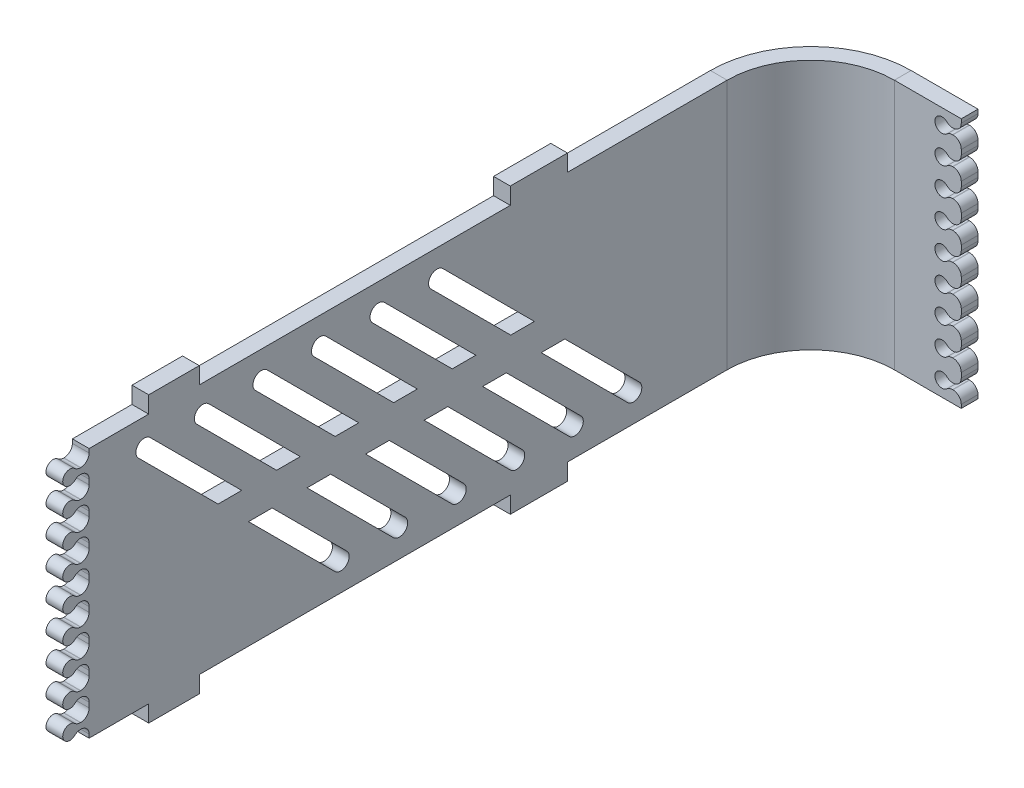
from build123d import *

# Parameters (mm, degrees)
BOSS_EXTRUDE1_DEPTH          = 5.08
EDGE_FLANGE1_STRIP_W         = 76.2
EDGE_FLANGE1_STRIP_H         = 5.08
EDGE_FLANGE1_STRIP_CUT_DEPTH = 76.2
EDGE_FLANGE1_DEPTH           = 76.2
EDGE_FLANGE1_START           = 5.08
EDGE_FLANGE1_FLAT_DEPTH      = 5.08
CUT_EXTRUDE2_DEPTH           = 242.670544012


# Sheet-metal steps are written as plain solids
with BuildPart() as part:
    # Sketch1 → Boss-Extrude1 (new body)
    with BuildSketch(Plane.XY):
        with BuildLine():
            Line((12.7, -38.1), (12.7, -37.011825379))
            ThreePointArc((12.7, -37.011825379), (11.956051224, -35.215774155), (10.16, -34.471825379))
            Line((10.16, -34.471825379), (10.028134089, -34.471825379))
            ThreePointArc((10.028134089, -34.471825379), (9.111928379, -34.642824093), (8.319084872, -35.132796169))
            ThreePointArc((8.319084872, -35.132796169), (4.69036112, -33.498380336), (8.362360336, -31.963657905))
            ThreePointArc((8.362360336, -31.963657905), (9.173613419, -32.48826627), (10.122080076, -32.6719957))
            Line((10.122080076, -32.6719957), (10.16, -32.6719957))
            ThreePointArc((10.16, -32.6719957), (11.956051224, -31.928046924), (12.7, -30.1319957))
            Line((12.7, -30.1319957), (12.7, -28.629825379))
            ThreePointArc((12.7, -28.629825379), (11.956051224, -26.833774155), (10.16, -26.089825379))
            Line((10.16, -26.089825379), (10.028134089, -26.089825379))
            ThreePointArc((10.028134089, -26.089825379), (9.111928379, -26.260824093), (8.319084872, -26.750796169))
            ThreePointArc((8.319084872, -26.750796169), (4.69036112, -25.116380336), (8.362360336, -23.581657905))
            ThreePointArc((8.362360336, -23.581657905), (9.173613419, -24.10626627), (10.122080076, -24.2899957))
            Line((10.122080076, -24.2899957), (10.16, -24.2899957))
            ThreePointArc((10.16, -24.2899957), (11.956051224, -23.546046924), (12.7, -21.7499957))
            Line((12.7, -21.7499957), (12.7, -20.247825379))
            ThreePointArc((12.7, -20.247825379), (11.956051224, -18.451774155), (10.16, -17.707825379))
            Line((10.16, -17.707825379), (10.028134089, -17.707825379))
            ThreePointArc((10.028134089, -17.707825379), (9.111928379, -17.878824093), (8.319084872, -18.368796169))
            ThreePointArc((8.319084872, -18.368796169), (4.69036112, -16.734380336), (8.362360336, -15.199657905))
            ThreePointArc((8.362360336, -15.199657905), (9.173613419, -15.72426627), (10.122080076, -15.9079957))
            Line((10.122080076, -15.9079957), (10.16, -15.9079957))
            ThreePointArc((10.16, -15.9079957), (11.956051224, -15.164046924), (12.7, -13.3679957))
            Line((12.7, -13.3679957), (12.7, -11.865825379))
            ThreePointArc((12.7, -11.865825379), (11.956051224, -10.069774155), (10.16, -9.325825379))
            Line((10.16, -9.325825379), (10.028134089, -9.325825379))
            ThreePointArc((10.028134089, -9.325825379), (9.111928379, -9.496824093), (8.319084872, -9.986796169))
            ThreePointArc((8.319084872, -9.986796169), (4.69036112, -8.352380336), (8.362360336, -6.817657905))
            ThreePointArc((8.362360336, -6.817657905), (9.173613419, -7.34226627), (10.122080076, -7.5259957))
            Line((10.122080076, -7.5259957), (10.16, -7.5259957))
            ThreePointArc((10.16, -7.5259957), (11.956051224, -6.782046924), (12.7, -4.9859957))
            Line((12.7, -4.9859957), (12.7, -3.483825379))
            ThreePointArc((12.7, -3.483825379), (11.956051224, -1.687774155), (10.16, -0.943825379))
            Line((10.16, -0.943825379), (10.028134089, -0.943825379))
            ThreePointArc((10.028134089, -0.943825379), (9.111928379, -1.114824093), (8.319084872, -1.604796169))
            ThreePointArc((8.319084872, -1.604796169), (4.69036112, 0.029619664), (8.362360336, 1.564342095))
            ThreePointArc((8.362360336, 1.564342095), (9.173613419, 1.03973373), (10.122080076, 0.8560043))
            Line((10.122080076, 0.8560043), (10.16, 0.8560043))
            ThreePointArc((10.16, 0.8560043), (11.956051224, 1.599953076), (12.7, 3.3960043))
            Line((12.7, 3.3960043), (12.7, 4.898174621))
            ThreePointArc((12.7, 4.898174621), (11.956051224, 6.694225845), (10.16, 7.438174621))
            Line((10.16, 7.438174621), (10.028134089, 7.438174621))
            ThreePointArc((10.028134089, 7.438174621), (9.111928379, 7.267175907), (8.319084872, 6.777203831))
            ThreePointArc((8.319084872, 6.777203831), (4.69036112, 8.411619664), (8.362360336, 9.946342095))
            ThreePointArc((8.362360336, 9.946342095), (9.173613419, 9.42173373), (10.122080076, 9.2380043))
            Line((10.122080076, 9.2380043), (10.16, 9.2380043))
            ThreePointArc((10.16, 9.2380043), (11.956051224, 9.981953076), (12.7, 11.7780043))
            Line((12.7, 11.7780043), (12.7, 13.280174621))
            ThreePointArc((12.7, 13.280174621), (11.956051224, 15.076225845), (10.16, 15.820174621))
            Line((10.16, 15.820174621), (10.028134089, 15.820174621))
            ThreePointArc((10.028134089, 15.820174621), (9.111928379, 15.649175907), (8.319084872, 15.159203831))
            ThreePointArc((8.319084872, 15.159203831), (4.69036112, 16.793619664), (8.362360336, 18.328342095))
            ThreePointArc((8.362360336, 18.328342095), (9.173613419, 17.80373373), (10.122080076, 17.6200043))
            Line((10.122080076, 17.6200043), (10.16, 17.6200043))
            ThreePointArc((10.16, 17.6200043), (11.956051224, 18.363953076), (12.7, 20.1600043))
            Line((12.7, 20.1600043), (12.7, 21.662174621))
            ThreePointArc((12.7, 21.662174621), (11.956051224, 23.458225845), (10.16, 24.202174621))
            Line((10.16, 24.202174621), (10.028134089, 24.202174621))
            ThreePointArc((10.028134089, 24.202174621), (9.111928379, 24.031175907), (8.319084872, 23.541203831))
            ThreePointArc((8.319084872, 23.541203831), (4.69036112, 25.175619664), (8.362360336, 26.710342095))
            ThreePointArc((8.362360336, 26.710342095), (9.173613419, 26.18573373), (10.122080076, 26.0020043))
            Line((10.122080076, 26.0020043), (10.16, 26.0020043))
            ThreePointArc((10.16, 26.0020043), (11.956051224, 26.745953076), (12.7, 28.5420043))
            Line((12.7, 28.5420043), (12.7, 30.044174621))
            ThreePointArc((12.7, 30.044174621), (11.956051224, 31.840225845), (10.16, 32.584174621))
            Line((10.16, 32.584174621), (10.028134089, 32.584174621))
            ThreePointArc((10.028134089, 32.584174621), (9.111928379, 32.413175907), (8.319084872, 31.923203831))
            ThreePointArc((8.319084872, 31.923203831), (4.69036112, 33.557619664), (8.362360336, 35.092342095))
            ThreePointArc((8.362360336, 35.092342095), (9.173613419, 34.56773373), (10.122080076, 34.3840043))
            Line((10.122080076, 34.3840043), (10.16, 34.3840043))
            ThreePointArc((10.16, 34.3840043), (11.956051224, 35.127953076), (12.7, 36.9240043))
            Line((12.7, 36.9240043), (12.7, 38.1))
            Line((12.7, 38.1), (-12.7, 38.1))
            Line((-12.7, 38.1), (-12.7, -38.1))
            Line((-12.7, -38.1), (12.7, -38.1))
        make_face()
    extrude(amount=BOSS_EXTRUDE1_DEPTH)

    # Edge-Flange1 strip (across the edge) → Edge-Flange1 strip cut (cut)
    with BuildSketch(Plane(origin=(-33.02, 38.1, 5.08), x_dir=(1, 0, 0), z_dir=(0, -1, 0))):
        with Locations((-12.7, -2.54)):
            Rectangle(EDGE_FLANGE1_STRIP_W, EDGE_FLANGE1_STRIP_H)
    extrude(amount=EDGE_FLANGE1_STRIP_CUT_DEPTH, mode=Mode.SUBTRACT)

    # Edge-Flange1 bend section (across the edge) → Edge-Flange1 (add)
    with BuildSketch(Plane(origin=(-33.02, 38.1, 5.08), x_dir=(1, 0, 0), z_dir=(0, -1, 0))):
        with BuildLine():
            Line((-5.08, 25.4), (0, 25.4))
            ThreePointArc((0, 25.4), (7.439487758, 7.439487758), (25.4, 0))
            Line((25.4, 0), (25.4, -5.08))
            ThreePointArc((25.4, -5.08), (3.847385309, 3.847385309), (-5.08, 25.4))
        make_face()
    extrude(amount=EDGE_FLANGE1_DEPTH)

    # Edge-Flange1 profile (on flange) → Edge-Flange1 flat (add)
    with BuildSketch(Plane(origin=(-33.02, 0, 5.08), x_dir=(0, -1, 0), z_dir=(-1, 0, 0)).offset(EDGE_FLANGE1_START)):
        with BuildLine():
            Line((-38.1, 73.894072455), (-38.1, 25.4))
            Line((-38.1, 25.4), (38.1, 25.4))
            Line((38.1, 25.4), (38.1, 73.894072455))
            Line((38.1, 73.894072455), (43.18, 73.894072455))
            Line((43.18, 73.894072455), (43.18, 91.265876827))
            Line((43.18, 91.265876827), (38.1, 91.265876827))
            Line((38.1, 91.265876827), (38.1, 185.742297035))
            Line((38.1, 185.742297035), (43.18, 185.742297035))
            Line((43.18, 185.742297035), (43.18, 201.096164536))
            Line((43.18, 201.096164536), (38.1, 201.096164536))
            Line((38.1, 201.096164536), (38.1, 219.202))
            Line((38.1, 219.202), (37.018011655, 219.202))
            ThreePointArc((37.018011655, 219.202), (35.221960431, 219.945948776), (34.478011655, 221.742))
            Line((34.478011655, 221.742), (34.478011655, 221.779919924))
            ThreePointArc((34.478011655, 221.779919924), (34.661741085, 222.728386581), (35.18634945, 223.539639664))
            ThreePointArc((35.18634945, 223.539639664), (33.651627019, 227.21163888), (32.017211185, 223.582915128))
            ThreePointArc((32.017211185, 223.582915128), (32.507183262, 222.790071621), (32.678181975, 221.873865911))
            Line((32.678181975, 221.873865911), (32.678181975, 221.742))
            ThreePointArc((32.678181975, 221.742), (31.9342332, 219.945948776), (30.138181975, 219.202))
            Line((30.138181975, 219.202), (28.636011655, 219.202))
            ThreePointArc((28.636011655, 219.202), (26.839960431, 219.945948776), (26.096011655, 221.742))
            Line((26.096011655, 221.742), (26.096011655, 221.779919924))
            ThreePointArc((26.096011655, 221.779919924), (26.279741085, 222.728386581), (26.80434945, 223.539639664))
            ThreePointArc((26.80434945, 223.539639664), (25.269627019, 227.21163888), (23.635211185, 223.582915128))
            ThreePointArc((23.635211185, 223.582915128), (24.125183262, 222.790071621), (24.296181975, 221.873865911))
            Line((24.296181975, 221.873865911), (24.296181975, 221.742))
            ThreePointArc((24.296181975, 221.742), (23.5522332, 219.945948776), (21.756181975, 219.202))
            Line((21.756181975, 219.202), (20.254011655, 219.202))
            ThreePointArc((20.254011655, 219.202), (18.457960431, 219.945948776), (17.714011655, 221.742))
            Line((17.714011655, 221.742), (17.714011655, 221.779919924))
            ThreePointArc((17.714011655, 221.779919924), (17.897741085, 222.728386581), (18.42234945, 223.539639664))
            ThreePointArc((18.42234945, 223.539639664), (16.887627019, 227.21163888), (15.253211185, 223.582915128))
            ThreePointArc((15.253211185, 223.582915128), (15.743183262, 222.790071621), (15.914181975, 221.873865911))
            Line((15.914181975, 221.873865911), (15.914181975, 221.742))
            ThreePointArc((15.914181975, 221.742), (15.1702332, 219.945948776), (13.374181975, 219.202))
            Line((13.374181975, 219.202), (11.872011655, 219.202))
            ThreePointArc((11.872011655, 219.202), (10.075960431, 219.945948776), (9.332011655, 221.742))
            Line((9.332011655, 221.742), (9.332011655, 221.779919924))
            ThreePointArc((9.332011655, 221.779919924), (9.515741085, 222.728386581), (10.04034945, 223.539639664))
            ThreePointArc((10.04034945, 223.539639664), (8.505627019, 227.21163888), (6.871211185, 223.582915128))
            ThreePointArc((6.871211185, 223.582915128), (7.361183262, 222.790071621), (7.532181975, 221.873865911))
            Line((7.532181975, 221.873865911), (7.532181975, 221.742))
            ThreePointArc((7.532181975, 221.742), (6.7882332, 219.945948776), (4.992181975, 219.202))
            Line((4.992181975, 219.202), (3.490011655, 219.202))
            ThreePointArc((3.490011655, 219.202), (1.693960431, 219.945948776), (0.950011655, 221.742))
            Line((0.950011655, 221.742), (0.950011655, 221.779919924))
            ThreePointArc((0.950011655, 221.779919924), (1.133741085, 222.728386581), (1.65834945, 223.539639664))
            ThreePointArc((1.65834945, 223.539639664), (0.123627019, 227.21163888), (-1.510788815, 223.582915128))
            ThreePointArc((-1.510788815, 223.582915128), (-1.020816738, 222.790071621), (-0.849818025, 221.873865911))
            Line((-0.849818025, 221.873865911), (-0.849818025, 221.742))
            ThreePointArc((-0.849818025, 221.742), (-1.5937668, 219.945948776), (-3.389818025, 219.202))
            Line((-3.389818025, 219.202), (-4.891988345, 219.202))
            ThreePointArc((-4.891988345, 219.202), (-6.688039569, 219.945948776), (-7.431988345, 221.742))
            Line((-7.431988345, 221.742), (-7.431988345, 221.779919924))
            ThreePointArc((-7.431988345, 221.779919924), (-7.248258915, 222.728386581), (-6.72365055, 223.539639664))
            ThreePointArc((-6.72365055, 223.539639664), (-8.258372981, 227.21163888), (-9.892788815, 223.582915128))
            ThreePointArc((-9.892788815, 223.582915128), (-9.402816738, 222.790071621), (-9.231818025, 221.873865911))
            Line((-9.231818025, 221.873865911), (-9.231818025, 221.742))
            ThreePointArc((-9.231818025, 221.742), (-9.9757668, 219.945948776), (-11.771818025, 219.202))
            Line((-11.771818025, 219.202), (-13.273988345, 219.202))
            ThreePointArc((-13.273988345, 219.202), (-15.070039569, 219.945948776), (-15.813988345, 221.742))
            Line((-15.813988345, 221.742), (-15.813988345, 221.779919924))
            ThreePointArc((-15.813988345, 221.779919924), (-15.630258915, 222.728386581), (-15.10565055, 223.539639664))
            ThreePointArc((-15.10565055, 223.539639664), (-16.640372981, 227.21163888), (-18.274788815, 223.582915128))
            ThreePointArc((-18.274788815, 223.582915128), (-17.784816738, 222.790071621), (-17.613818025, 221.873865911))
            Line((-17.613818025, 221.873865911), (-17.613818025, 221.742))
            ThreePointArc((-17.613818025, 221.742), (-18.3577668, 219.945948776), (-20.153818025, 219.202))
            Line((-20.153818025, 219.202), (-21.655988345, 219.202))
            ThreePointArc((-21.655988345, 219.202), (-23.452039569, 219.945948776), (-24.195988345, 221.742))
            Line((-24.195988345, 221.742), (-24.195988345, 221.779919924))
            ThreePointArc((-24.195988345, 221.779919924), (-24.012258915, 222.728386581), (-23.48765055, 223.539639664))
            ThreePointArc((-23.48765055, 223.539639664), (-25.022372981, 227.21163888), (-26.656788815, 223.582915128))
            ThreePointArc((-26.656788815, 223.582915128), (-26.166816738, 222.790071621), (-25.995818025, 221.873865911))
            Line((-25.995818025, 221.873865911), (-25.995818025, 221.742))
            ThreePointArc((-25.995818025, 221.742), (-26.7397668, 219.945948776), (-28.535818025, 219.202))
            Line((-28.535818025, 219.202), (-30.037988345, 219.202))
            ThreePointArc((-30.037988345, 219.202), (-31.834039569, 219.945948776), (-32.577988345, 221.742))
            Line((-32.577988345, 221.742), (-32.577988345, 221.779919924))
            ThreePointArc((-32.577988345, 221.779919924), (-32.394258915, 222.728386581), (-31.86965055, 223.539639664))
            ThreePointArc((-31.86965055, 223.539639664), (-33.404372981, 227.21163888), (-35.038788815, 223.582915128))
            ThreePointArc((-35.038788815, 223.582915128), (-34.548816738, 222.790071621), (-34.377818025, 221.873865911))
            Line((-34.377818025, 221.873865911), (-34.377818025, 221.742))
            ThreePointArc((-34.377818025, 221.742), (-35.1217668, 219.945948776), (-36.917818025, 219.202))
            Line((-36.917818025, 219.202), (-38.1, 219.202))
            Line((-38.1, 219.202), (-38.1, 201.096164536))
            Line((-38.1, 201.096164536), (-43.18, 201.096164536))
            Line((-43.18, 201.096164536), (-43.18, 185.742297035))
            Line((-43.18, 185.742297035), (-38.1, 185.742297035))
            Line((-38.1, 185.742297035), (-38.1, 91.265876827))
            Line((-38.1, 91.265876827), (-43.18, 91.265876827))
            Line((-43.18, 91.265876827), (-43.18, 73.894072455))
            Line((-43.18, 73.894072455), (-38.1, 73.894072455))
        make_face()
    extrude(amount=-EDGE_FLANGE1_FLAT_DEPTH)

    # Sketch8 → Cut-Extrude2 (cut, through all)
    with BuildSketch(Plane.ZY.offset(38.1)):
        with BuildLine():
            Line((209.32620512, 28.123097774), (185.108242407, 3.905135062))
            Line((185.108242407, 3.905135062), (177.924037511, 3.905135062))
            Line((177.924037511, 3.905135062), (205.734102672, 31.715200222))
            ThreePointArc((205.734102672, 31.715200222), (209.32620512, 31.715200222), (209.32620512, 28.123097774))
        make_face()
        with BuildLine():
            Line((191.54620512, 28.123097774), (167.328242407, 3.905135062))
            Line((167.328242407, 3.905135062), (160.144037511, 3.905135062))
            Line((160.144037511, 3.905135062), (187.954102672, 31.715200222))
            ThreePointArc((187.954102672, 31.715200222), (191.54620512, 31.715200222), (191.54620512, 28.123097774))
        make_face()
        with BuildLine():
            Line((173.76620512, 28.123097774), (149.548242407, 3.905135062))
            Line((149.548242407, 3.905135062), (142.364037511, 3.905135062))
            Line((142.364037511, 3.905135062), (170.174102672, 31.715200222))
            ThreePointArc((170.174102672, 31.715200222), (173.76620512, 31.715200222), (173.76620512, 28.123097774))
        make_face()
        with BuildLine():
            Line((155.98620512, 28.123097774), (131.768242407, 3.905135062))
            Line((131.768242407, 3.905135062), (124.584037511, 3.905135062))
            Line((124.584037511, 3.905135062), (152.394102672, 31.715200222))
            ThreePointArc((152.394102672, 31.715200222), (155.98620512, 31.715200222), (155.98620512, 28.123097774))
        make_face()
        with BuildLine():
            Line((138.20620512, 28.123097774), (113.988242407, 3.905135062))
            Line((113.988242407, 3.905135062), (106.804037511, 3.905135062))
            Line((106.804037511, 3.905135062), (134.614102672, 31.715200222))
            ThreePointArc((134.614102672, 31.715200222), (138.20620512, 31.715200222), (138.20620512, 28.123097774))
        make_face()
        with BuildLine():
            Line((120.42620512, 28.123097774), (96.208242407, 3.905135062))
            Line((96.208242407, 3.905135062), (89.024037511, 3.905135062))
            Line((89.024037511, 3.905135062), (116.834102672, 31.715200222))
            ThreePointArc((116.834102672, 31.715200222), (120.42620512, 31.715200222), (120.42620512, 28.123097774))
        make_face()
        with BuildLine():
            Line((175.858320599, -5.344786747), (149.627510381, -31.575596965))
            ThreePointArc((149.627510381, -31.575596965), (146.035407932, -31.575596965), (146.035407932, -27.983494517))
            Line((146.035407932, -27.983494517), (168.674115702, -5.344786747))
            Line((168.674115702, -5.344786747), (175.858320599, -5.344786747))
        make_face()
        with BuildLine():
            Line((158.078320599, -5.344786747), (131.847510381, -31.575596965))
            ThreePointArc((131.847510381, -31.575596965), (128.255407932, -31.575596965), (128.255407932, -27.983494517))
            Line((128.255407932, -27.983494517), (150.894115702, -5.344786747))
            Line((150.894115702, -5.344786747), (158.078320599, -5.344786747))
        make_face()
        with BuildLine():
            Line((140.298320599, -5.344786747), (114.067510381, -31.575596965))
            ThreePointArc((114.067510381, -31.575596965), (110.475407932, -31.575596965), (110.475407932, -27.983494517))
            Line((110.475407932, -27.983494517), (133.114115702, -5.344786747))
            Line((133.114115702, -5.344786747), (140.298320599, -5.344786747))
        make_face()
        with BuildLine():
            Line((122.518320599, -5.344786747), (96.287510381, -31.575596965))
            ThreePointArc((96.287510381, -31.575596965), (92.695407932, -31.575596965), (92.695407932, -27.983494517))
            Line((92.695407932, -27.983494517), (115.334115702, -5.344786747))
            Line((115.334115702, -5.344786747), (122.518320599, -5.344786747))
        make_face()
        with BuildLine():
            Line((104.738320599, -5.344786747), (78.507510381, -31.575596965))
            ThreePointArc((78.507510381, -31.575596965), (74.915407932, -31.575596965), (74.915407932, -27.983494517))
            Line((74.915407932, -27.983494517), (97.554115702, -5.344786747))
            Line((97.554115702, -5.344786747), (104.738320599, -5.344786747))
        make_face()
        with BuildLine():
            Line((86.958320599, -5.344786747), (60.727510381, -31.575596965))
            ThreePointArc((60.727510381, -31.575596965), (57.135407932, -31.575596965), (57.135407932, -27.983494517))
            Line((57.135407932, -27.983494517), (79.774115702, -5.344786747))
            Line((79.774115702, -5.344786747), (86.958320599, -5.344786747))
        make_face()
    extrude(amount=-CUT_EXTRUDE2_DEPTH, mode=Mode.SUBTRACT)


solid = part.part
